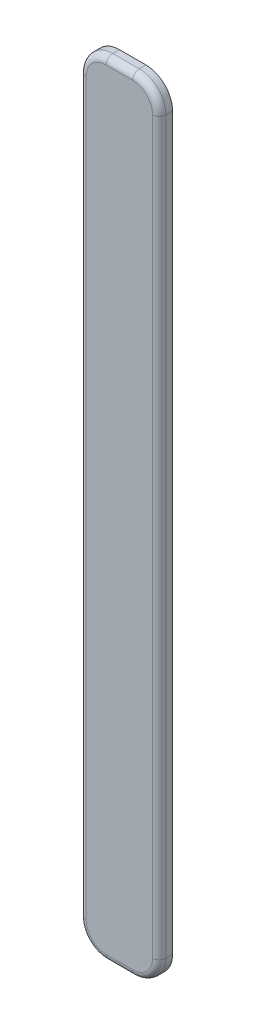
from build123d import *

# Parameters (mm, degrees)
SKETCH_1_W      = 12
SKETCH_1_H      = 118
EXTRUDE_1_DEPTH = 2
FILLET_1_R      = 4
FILLET_2_R      = 1


with BuildPart() as part:
    # Эскиз1 → Бобышка-Вытянуть1 (new body)
    with BuildSketch(Plane.XY):
        with Locations((6, 59)):
            Rectangle(SKETCH_1_W, SKETCH_1_H)
    extrude(amount=EXTRUDE_1_DEPTH)

    # Скругление1
    fillet_1_edges = [part.edges().sort_by_distance(p)[0] for p in [
        (0, 0, 1),
        (12, 0, 1),
        (0, 118, 1),
        (12, 118, 1),
    ]]
    fillet(fillet_1_edges, radius=FILLET_1_R)

    # Скругление2
    fillet_2_edges = [part.edges().sort_by_distance(p)[0] for p in [
        (1.171572875, 116.828427125, 2),
        (6, 118, 2),
        (10.828427125, 116.828427125, 2),
        (12, 59, 2),
        (10.828427125, 1.171572875, 2),
        (6, 0, 2),
        (1.171572875, 1.171572875, 2),
        (0, 59, 2),
    ]]
    fillet(fillet_2_edges, radius=FILLET_2_R)


solid = part.part
